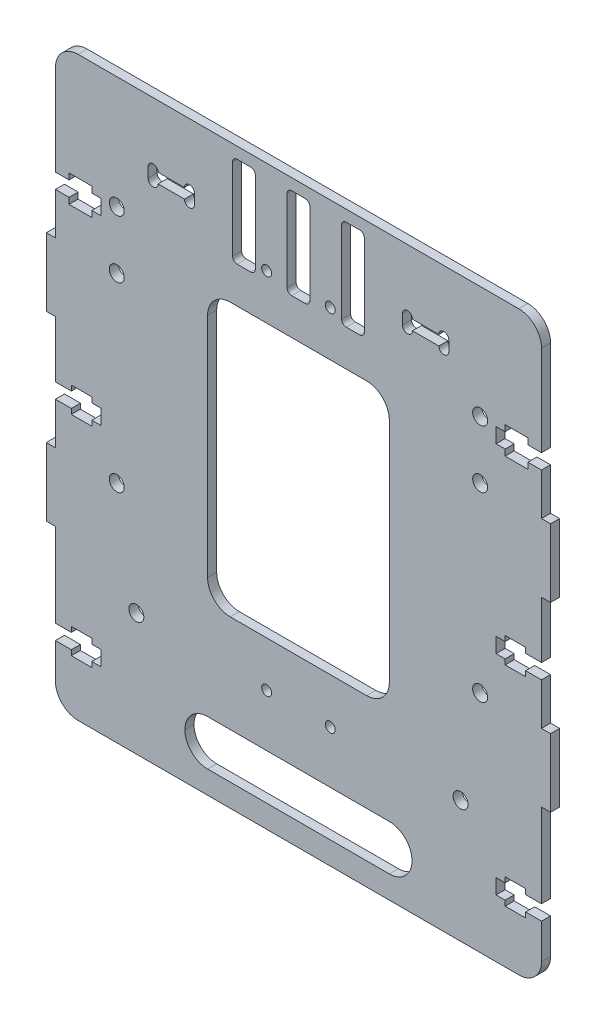
from build123d import *

# Parameters (mm, degrees)
SKETCH_1_W           = 107
SKETCH_1_H           = 25
EXTRUDE_1_DEPTH      = 2
SKETCH_3_W           = 107
SKETCH_3_H           = 2
EXTRUDE_2_DEPTH      = 10
CUT_EXTRUDE_2_DEPTH  = 2
SKETCH_6_R           = 1.65
CUT_EXTRUDE_4_DEPTH  = 10
SKETCH_7_W           = 107
SKETCH_7_H           = 2
EXTRUDE_3_DEPTH      = 100
SKETCH_8_R           = 1.1
CUT_EXTRUDE_5_DEPTH  = 50
SKETCH_9_W           = 40
SKETCH_9_H           = 60
CUT_EXTRUDE_6_DEPTH  = 50
FILLET_3_R           = 5
SKETCH_10_W          = 2
SKETCH_10_H          = 15
EXTRUDE_4_DEPTH      = 2
CUT_EXTRUDE_7_DEPTH  = 50
SKETCH_12_R          = 1.65
CUT_EXTRUDE_8_DEPTH  = 50
SKETCH_13_R          = 1.65
CUT_EXTRUDE_9_DEPTH  = 10
SKETCH_14_R          = 1.65
CUT_EXTRUDE_10_DEPTH = 10
SKETCH_16_W          = 107
SKETCH_16_H          = 8
CUT_EXTRUDE_11_DEPTH = 10
FILLET_4_R           = 5
EXTRUDE_6_DEPTH      = 2
CUT_EXTRUDE_12_DEPTH = 10
SKETCH_19_W          = 50
SKETCH_19_H          = 30
CUT_EXTRUDE_13_DEPTH = 10
FILLET_5_R           = 5
SKETCH_20_W          = 73.95
SKETCH_20_H          = 5
EXTRUDE_8_DEPTH      = 2
FILLET_6_R           = 5


with BuildPart() as part:
    # 草图1 → 凸台-拉伸1 (new body)
    with BuildSketch(Plane.XY):
        Rectangle(SKETCH_1_W, SKETCH_1_H)
    extrude(amount=EXTRUDE_1_DEPTH)

    # 草图3 → 凸台-拉伸2 (add)
    with BuildSketch(Plane.XZ.offset(12.5)):
        with Locations((0, 1)):
            Rectangle(SKETCH_3_W, SKETCH_3_H)
    extrude(amount=EXTRUDE_2_DEPTH)

    # 草图4 → 切除-拉伸2 (cut)
    with BuildSketch(Plane.XY.offset(2)):
        with BuildLine():
            Line((-25.1, -3.4), (-30.9, -3.4))
            ThreePointArc((-30.9, -3.4), (-32, -4.5), (-33.1, -3.4))
            Line((-33.1, -3.4), (-33.1, -1.2))
            ThreePointArc((-33.1, -1.2), (-32, -0.1), (-30.9, -1.2))
            Line((-30.9, -1.2), (-25.1, -1.2))
            ThreePointArc((-25.1, -1.2), (-24, -0.1), (-22.9, -1.2))
            Line((-22.9, -1.2), (-22.9, -3.4))
            ThreePointArc((-22.9, -3.4), (-24, -4.5), (-25.1, -3.4))
        make_face()
        with BuildLine():
            Line((22.9, -3.4), (22.9, -1.2))
            ThreePointArc((22.9, -1.2), (24, -0.1), (25.1, -1.2))
            Line((25.1, -1.2), (30.9, -1.2))
            ThreePointArc((30.9, -1.2), (32, -0.1), (33.1, -1.2))
            Line((33.1, -1.2), (33.1, -3.4))
            ThreePointArc((33.1, -3.4), (32, -4.5), (30.9, -3.4))
            Line((30.9, -3.4), (25.1, -3.4))
            ThreePointArc((25.1, -3.4), (24, -4.5), (22.9, -3.4))
        make_face()
    extrude(amount=-CUT_EXTRUDE_2_DEPTH, mode=Mode.SUBTRACT)

    # 草图6 → 切除-拉伸4 (cut)
    with BuildSketch(Plane(origin=(0, 0, 0), x_dir=(-1, 0, 0), z_dir=(0, 0, -1))):
        with Locations((-40, -9.3)):
            Circle(SKETCH_6_R)
        with Locations((40, -9.3)):
            Circle(SKETCH_6_R)
    extrude(amount=-CUT_EXTRUDE_4_DEPTH, mode=Mode.SUBTRACT)

    # 草图7 → 凸台-拉伸3 (add)
    with BuildSketch(Plane.XZ.offset(22.5)):
        with Locations((0, 1)):
            Rectangle(SKETCH_7_W, SKETCH_7_H)
    extrude(amount=EXTRUDE_3_DEPTH)

    # 草图8 → 切除-拉伸5 (cut)
    with BuildSketch(Plane(origin=(0, 0, 0), x_dir=(-1, 0, 0), z_dir=(0, 0, -1))):
        with Locations((-7, -8)):
            Circle(SKETCH_8_R)
        with Locations((7, -8)):
            Circle(SKETCH_8_R)
        with Locations((-7, -88)):
            Circle(SKETCH_8_R)
        with Locations((7, -88)):
            Circle(SKETCH_8_R)
    extrude(amount=-CUT_EXTRUDE_5_DEPTH, mode=Mode.SUBTRACT)

    # 草图9 → 切除-拉伸6 (cut)
    with BuildSketch(Plane(origin=(0, 0, 0), x_dir=(-1, 0, 0), z_dir=(0, 0, -1))):
        with Locations((0, -48)):
            Rectangle(SKETCH_9_W, SKETCH_9_H)
    extrude(amount=-CUT_EXTRUDE_6_DEPTH, mode=Mode.SUBTRACT)

    # 圆角3
    fillet_3_edges = [part.edges().sort_by_distance(p)[0] for p in [
        (20, -78, 1),
        (20, -18, 1),
        (-20, -18, 1),
        (-20, -78, 1),
    ]]
    fillet(fillet_3_edges, radius=FILLET_3_R)

    # 草图10 → 凸台-拉伸4 (add)
    with BuildSketch(Plane(origin=(0, 0, 0), x_dir=(-1, 0, 0), z_dir=(0, 0, -1))):
        with Locations((-54.5, -32.5)):
            Rectangle(SKETCH_10_W, SKETCH_10_H)
        with Locations((-54.5, -72.5)):
            Rectangle(SKETCH_10_W, SKETCH_10_H)
        with Locations((54.5, -32.5)):
            Rectangle(SKETCH_10_W, SKETCH_10_H)
        with Locations((54.5, -72.5)):
            Rectangle(SKETCH_10_W, SKETCH_10_H)
    extrude(amount=-EXTRUDE_4_DEPTH)

    # 草图11 → 切除-拉伸7 (cut)
    with BuildSketch(Plane.XY.offset(2)):
        Polygon((-53.5, -15.75), (-50.5, -15.75), (-50.5, -17.1), (-45.5, -17.1), (-45.5, -15.75), (-43.5, -15.75), (-43.5, -12.45), (-45.5, -12.45), (-45.5, -11.1), (-50.5, -11.1), (-50.5, -12.45), (-53.5, -12.45), align=None)
        Polygon((-53.5, -52.45), (-50, -52.45), (-50, -51.3), (-45.5, -51.3), (-45.5, -52.45), (-43.5, -52.45), (-43.5, -55.75), (-45.5, -55.75), (-45.5, -56.9), (-50, -56.9), (-50, -55.75), (-53.5, -55.75), align=None)
        Polygon((-53.5, -98.45), (-50, -98.45), (-50, -97.3), (-45.5, -97.3), (-45.5, -98.45), (-43.5, -98.45), (-43.5, -101.75), (-45.5, -101.75), (-45.5, -102.9), (-50, -102.9), (-50, -101.75), (-53.5, -101.75), align=None)
        Polygon((45.5, -102.9), (45.5, -101.75), (43.5, -101.75), (43.5, -98.45), (45.5, -98.45), (45.5, -97.3), (50, -97.3), (50, -98.45), (53.5, -98.45), (53.5, -101.75), (50, -101.75), (50, -102.9), align=None)
        Polygon((45.5, -56.9), (45.5, -55.75), (43.5, -55.75), (43.5, -52.45), (45.5, -52.45), (45.5, -51.3), (50, -51.3), (50, -52.45), (53.5, -52.45), (53.5, -55.75), (50, -55.75), (50, -56.9), align=None)
        Polygon((45.5, -17.1), (45.5, -15.75), (43.5, -15.75), (43.5, -12.45), (45.5, -12.45), (45.5, -11.1), (50.5, -11.1), (50.5, -12.45), (53.5, -12.45), (53.5, -15.75), (50.5, -15.75), (50.5, -17.1), align=None)
    extrude(amount=-CUT_EXTRUDE_7_DEPTH, mode=Mode.SUBTRACT)

    # 草图12 → 切除-拉伸8 (cut)
    with BuildSketch(Plane.XY.offset(2)):
        with Locations((-35.69, -87.6)):
            Circle(SKETCH_12_R)
        with Locations((35.69, -87.6)):
            Circle(SKETCH_12_R)
    extrude(amount=-CUT_EXTRUDE_8_DEPTH, mode=Mode.SUBTRACT)

    # 草图13 → 切除-拉伸9 (cut)
    with BuildSketch(Plane.XY.offset(2)):
        with Locations((-40, -25)):
            Circle(SKETCH_13_R)
        with Locations((40, -25)):
            Circle(SKETCH_13_R)
        with Locations((40, -65)):
            Circle(SKETCH_13_R)
        with Locations((-40, -65)):
            Circle(SKETCH_13_R)
    extrude(amount=-CUT_EXTRUDE_9_DEPTH, mode=Mode.SUBTRACT)

    # 草图14 → 切除-拉伸10 (cut)
    with BuildSketch(Plane.XY.offset(2)):
        with Locations((-40, -12.3)):
            Circle(SKETCH_14_R)
        with Locations((40, -12.3)):
            Circle(SKETCH_14_R)
    extrude(amount=-CUT_EXTRUDE_10_DEPTH, mode=Mode.SUBTRACT)

    # 草图16 → 切除-拉伸11 (cut)
    with BuildSketch(Plane.XY.offset(2)):
        with Locations((0, -118.5)):
            Rectangle(SKETCH_16_W, SKETCH_16_H)
    extrude(amount=-CUT_EXTRUDE_11_DEPTH, mode=Mode.SUBTRACT)

    # 圆角4
    fillet_4_edges = [part.edges().sort_by_distance(p)[0] for p in [
        (-53.5, -114.5, 1),
        (53.5, -114.5, 1),
        (-53.5, 12.5, 1),
        (53.5, 12.5, 1),
    ]]
    fillet(fillet_4_edges, radius=FILLET_4_R)

    # 草图17 → 凸台-拉伸6 (add)
    with BuildSketch(Plane.XY.offset(2)):
        with BuildLine():
            ThreePointArc((-39.312613646, -10.8), (-40, -7.65), (-40.687386354, -10.8))
            ThreePointArc((-40.687386354, -10.8), (-40, -10.65), (-39.312613646, -10.8))
        make_face()
        with BuildLine():
            ThreePointArc((39.312613646, -10.8), (40, -10.65), (40.687386354, -10.8))
            ThreePointArc((40.687386354, -10.8), (40, -7.65), (39.312613646, -10.8))
        make_face()
    extrude(amount=-EXTRUDE_6_DEPTH)

    # 草图18 → 切除-拉伸12 (cut)
    with BuildSketch(Plane.XY.offset(2)):
        with BuildLine():
            Line((9.5, -9), (9.5, 9))
            ThreePointArc((9.5, 9), (9.792893219, 9.707106781), (10.5, 10))
            Line((10.5, 10), (13.5, 10))
            ThreePointArc((13.5, 10), (14.207106781, 9.707106781), (14.5, 9))
            Line((14.5, 9), (14.5, -9))
            ThreePointArc((14.5, -9), (14.207106781, -9.707106781), (13.5, -10))
            Line((13.5, -10), (10.5, -10))
            ThreePointArc((10.5, -10), (9.792893219, -9.707106781), (9.5, -9))
        make_face()
        with BuildLine():
            Line((-1.5, -10), (1.5, -10))
            ThreePointArc((1.5, -10), (2.207106781, -9.707106781), (2.5, -9))
            Line((2.5, -9), (2.5, 9))
            ThreePointArc((2.5, 9), (2.207106781, 9.707106781), (1.5, 10))
            Line((1.5, 10), (-1.5, 10))
            ThreePointArc((-1.5, 10), (-2.207106781, 9.707106781), (-2.5, 9))
            Line((-2.5, 9), (-2.5, -9))
            ThreePointArc((-2.5, -9), (-2.207106781, -9.707106781), (-1.5, -10))
        make_face()
        with BuildLine():
            Line((-14.5, -9), (-14.5, 9))
            ThreePointArc((-14.5, 9), (-14.207106781, 9.707106781), (-13.5, 10))
            Line((-13.5, 10), (-10.5, 10))
            ThreePointArc((-10.5, 10), (-9.792893219, 9.707106781), (-9.5, 9))
            Line((-9.5, 9), (-9.5, -9))
            ThreePointArc((-9.5, -9), (-9.792893219, -9.707106781), (-10.5, -10))
            Line((-10.5, -10), (-13.5, -10))
            ThreePointArc((-13.5, -10), (-14.207106781, -9.707106781), (-14.5, -9))
        make_face()
    extrude(amount=-CUT_EXTRUDE_12_DEPTH, mode=Mode.SUBTRACT)

    # 草图19 → 切除-拉伸13 (cut)
    with BuildSketch(Plane(origin=(0, 0, 0), x_dir=(-1, 0, 0), z_dir=(0, 0, -1))):
        with Locations((0, -114.5)):
            Rectangle(SKETCH_19_W, SKETCH_19_H)
    extrude(amount=-CUT_EXTRUDE_13_DEPTH, mode=Mode.SUBTRACT)

    # 圆角5
    fillet_5_edges = [part.edges().sort_by_distance(p)[0] for p in [
        (-25, -114.5, 1),
        (25, -114.5, 1),
        (25, -99.5, 1),
        (-25, -99.5, 1),
    ]]
    fillet(fillet_5_edges, radius=FILLET_5_R)

    # 草图20 → 凸台-拉伸8 (add)
    with BuildSketch(Plane.XY.offset(2)):
        with Locations((-1.118962094, -112)):
            Rectangle(SKETCH_20_W, SKETCH_20_H)
    extrude(amount=-EXTRUDE_8_DEPTH)

    # 圆角6
    fillet_6_edges = [part.edges().sort_by_distance(p)[0] for p in [
        (25, -109.5, 1),
        (-25, -109.5, 1),
    ]]
    fillet(fillet_6_edges, radius=FILLET_6_R - 0.0001)  # a hair under: the kernel refuses the full size


solid = part.part
